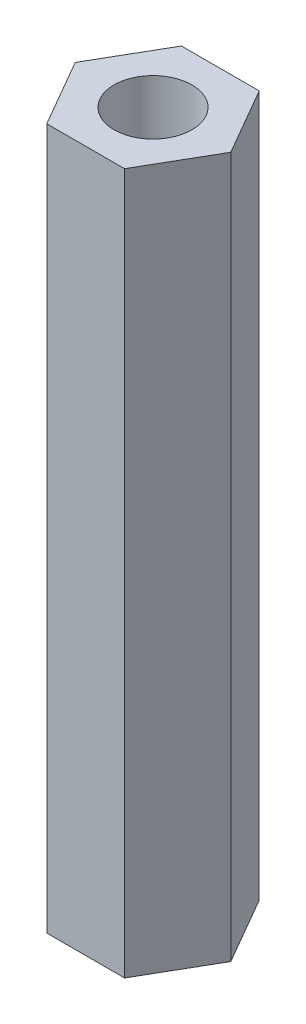
from build123d import *

# Parameters (mm, degrees)
SKETCH1_R           = 1.5
BOSS_EXTRUDE1_DEPTH = 27


with BuildPart() as part:
    # Sketch1 → Boss-Extrude1 (new body)
    with BuildSketch(Plane(origin=(0, 0, 0), x_dir=(1, 0, 0), z_dir=(0, 1, 0))):
        Polygon((2.99601055, 0), (1.498005275, 2.594621246), (-1.498005275, 2.594621246), (-2.99601055, 0), (-1.498005275, -2.594621246), (1.498005275, -2.594621246), align=None)
        Circle(SKETCH1_R, mode=Mode.SUBTRACT)
    extrude(amount=BOSS_EXTRUDE1_DEPTH)


solid = part.part
